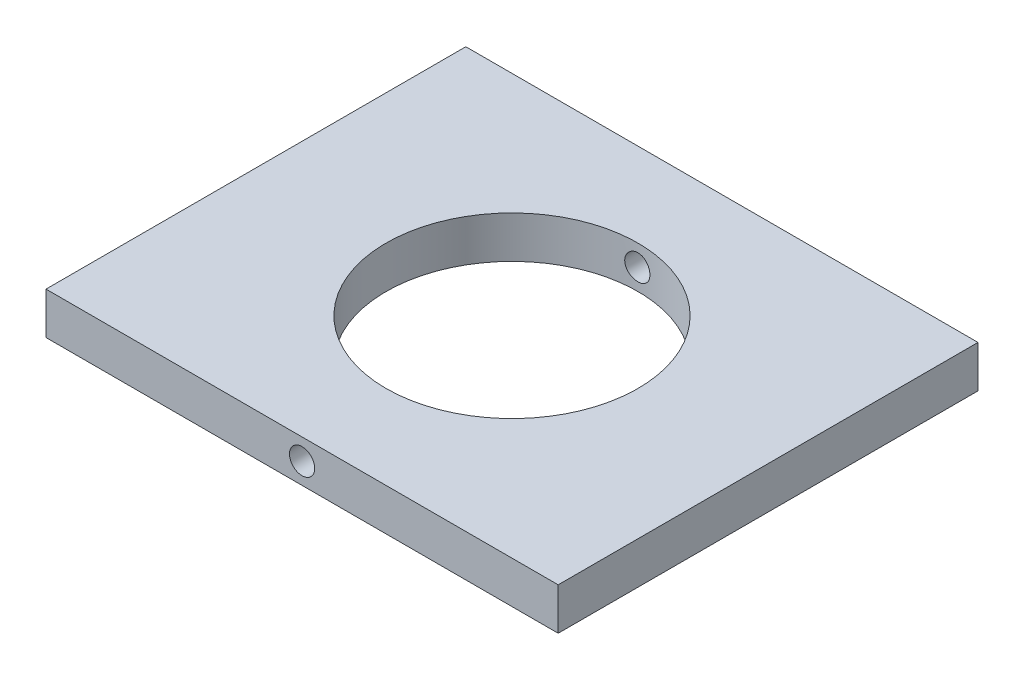
from build123d import *

# Parameters (mm, degrees)
ESQUISSE1_W             = 61
ESQUISSE1_H             = 5
BOSS_EXTRU_1_DEPTH      = 50
ESQUISSE2_R             = 15
ENL_V_MAT_EXTRU_1_DEPTH = 73.672209269
ESQUISSE5_R             = 1.5
ENL_V_MAT_EXTRU_4_DEPTH = 89.069574769


with BuildPart() as part:
    # Esquisse1 → Boss.-Extru.1 (new body)
    with BuildSketch(Plane.XY):
        with Locations((22, -47.5)):
            Rectangle(ESQUISSE1_W, ESQUISSE1_H)
    extrude(amount=BOSS_EXTRU_1_DEPTH)

    # Esquisse2 → Enlèv. mat.-Extru.1 (cut, through all)
    with BuildSketch(Plane(origin=(0, -45, 0), x_dir=(-1, 0, 0), z_dir=(0, 1, 0))):
        with Locations((-22, 25)):
            Circle(ESQUISSE2_R)
    extrude(amount=-ENL_V_MAT_EXTRU_1_DEPTH, mode=Mode.SUBTRACT)

    # Esquisse5 → Enlèv. mat.-Extru.4 (cut, through all)
    with BuildSketch(Plane.XY.offset(50)):
        with Locations((22, -47.5)):
            Circle(ESQUISSE5_R)
    extrude(amount=-ENL_V_MAT_EXTRU_4_DEPTH, mode=Mode.SUBTRACT)


solid = part.part
